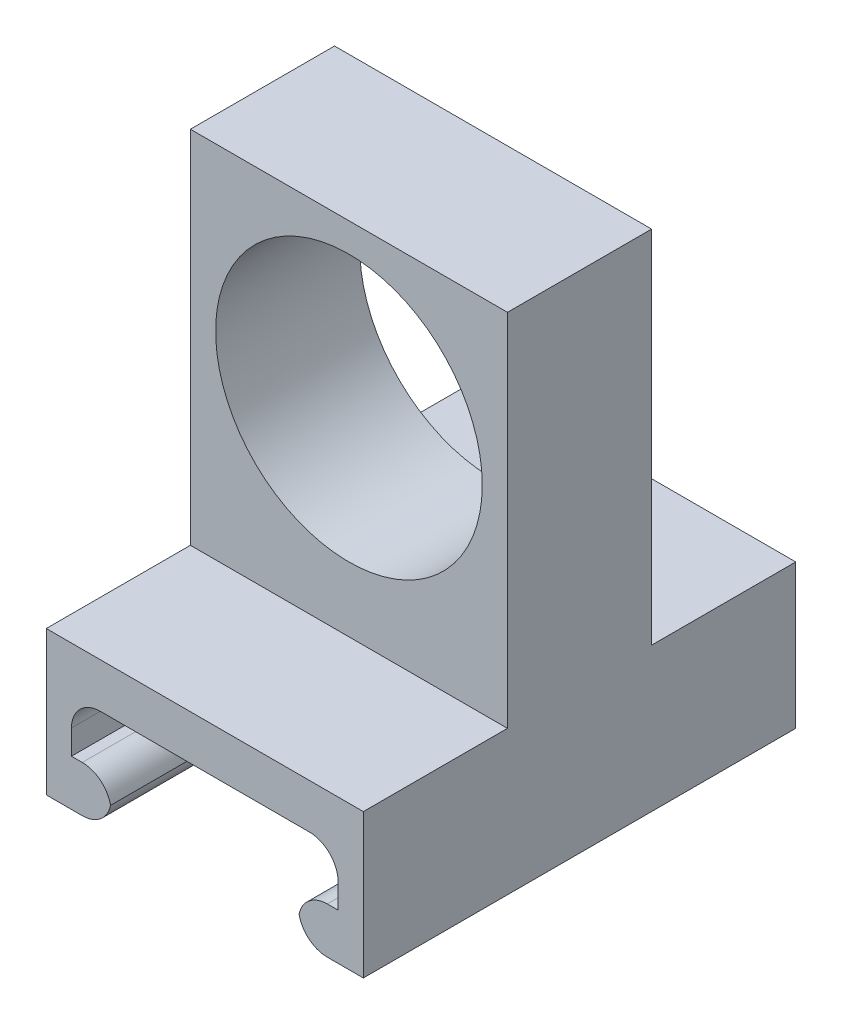
from build123d import *

# Parameters (mm, degrees)
SKETCH1_W           = 22
SKETCH1_H           = 30
BOSS_EXTRUDE1_DEPTH = 10
CUT_EXTRUDE1_DEPTH  = 34.925879042
FILLET1_R           = 2
SKETCH4_W           = 22
SKETCH4_H           = 10
BOSS_EXTRUDE2_DEPTH = 25
CUT_EXTRUDE2_REACH  = 44.142
SKETCH5_R           = 9.25


with BuildPart() as part:
    # Sketch1 → Boss-Extrude1 (new body)
    with BuildSketch(Plane(origin=(0, 0, 0), x_dir=(1, 0, 0), z_dir=(0, 1, 0))):
        with Locations((1.286792453, -6.677358491)):
            Rectangle(SKETCH1_W, SKETCH1_H)
    extrude(amount=BOSS_EXTRUDE1_DEPTH)

    # Sketch2 → Cut-Extrude1 (cut, through all)
    with BuildSketch(Plane.XY.offset(21.677358491)):
        Polygon((-7.963207547, 6.9), (10.536792453, 6.9), (10.536792453, 3.2), (7.786792453, 3.2), (7.786792453, 0), (-5.213207547, 0), (-5.213207547, 3.2), (-7.963207547, 3.2), align=None)
    extrude(amount=-CUT_EXTRUDE1_DEPTH, mode=Mode.SUBTRACT)

    # Fillet1
    # the kernel refuses this fillet: 2 mm, written as the material it adds along each edge
    with BuildSketch(Plane(origin=(10.536792453, 6.9, 21.677358491), x_dir=(-1, 0, 0), z_dir=(0, 0, -1)), Plane(origin=(-7.963207547, 6.9, 21.677358491), x_dir=(0, -1, 0), z_dir=(0, 0, -1))) as fillet1_piece_1:
        with BuildLine():
            CenterArc((FILLET1_R, -FILLET1_R), FILLET1_R, 90, 90)
            Line((0, -FILLET1_R), (0, 0))
            Line((0, 0), (FILLET1_R, 0))
        make_face()
    extrude(amount=30)
    # the kernel refuses this fillet: 2 mm, written as the material it takes off along each edge
    with BuildSketch(Plane(origin=(-5.213207547, 0, 26.677358491), x_dir=(-1, 0, 0), z_dir=(0, 0, -1)), Plane(origin=(7.786792453, 0, 26.677358491), x_dir=(0, 1, 0), z_dir=(0, 0, -1)), Plane(origin=(7.786792453, 3.2, 26.677358491), x_dir=(1, 0, 0), z_dir=(0, 0, -1)), Plane(origin=(-5.213207547, 3.2, 26.677358491), x_dir=(0, -1, 0), z_dir=(0, 0, -1))) as fillet1_2_piece_1:
        with BuildLine():
            CenterArc((FILLET1_R, FILLET1_R), FILLET1_R, 180, 90)
            Line((0, FILLET1_R), (0, 0))
            Line((0, 0), (FILLET1_R, 0))
        make_face()
    extrude(amount=40, mode=Mode.SUBTRACT)

    # Sketch4 → Boss-Extrude2 (add)
    with BuildSketch(Plane(origin=(0, 10, 0), x_dir=(1, 0, 0), z_dir=(0, 1, 0))):
        with Locations((1.286792453, -6.677358491)):
            Rectangle(SKETCH4_W, SKETCH4_H)
    extrude(amount=BOSS_EXTRUDE2_DEPTH)

    # Sketch5 → Cut-Extrude2 (cut, up to next)
    with BuildSketch(Plane.XY.offset(11.677358491), mode=Mode.PRIVATE) as cut_extrude2_sk1:
        with Locations((1.286792453, 23.746)):
            Circle(SKETCH5_R)
    cut_extrude2_tool1 = extrude(cut_extrude2_sk1.sketch, amount=-CUT_EXTRUDE2_REACH, mode=Mode.PRIVATE) & part.part
    add(cut_extrude2_tool1.solids().sort_by_distance((1.286792, 23.746, 11.677358))[0], mode=Mode.SUBTRACT)


solid = part.part
